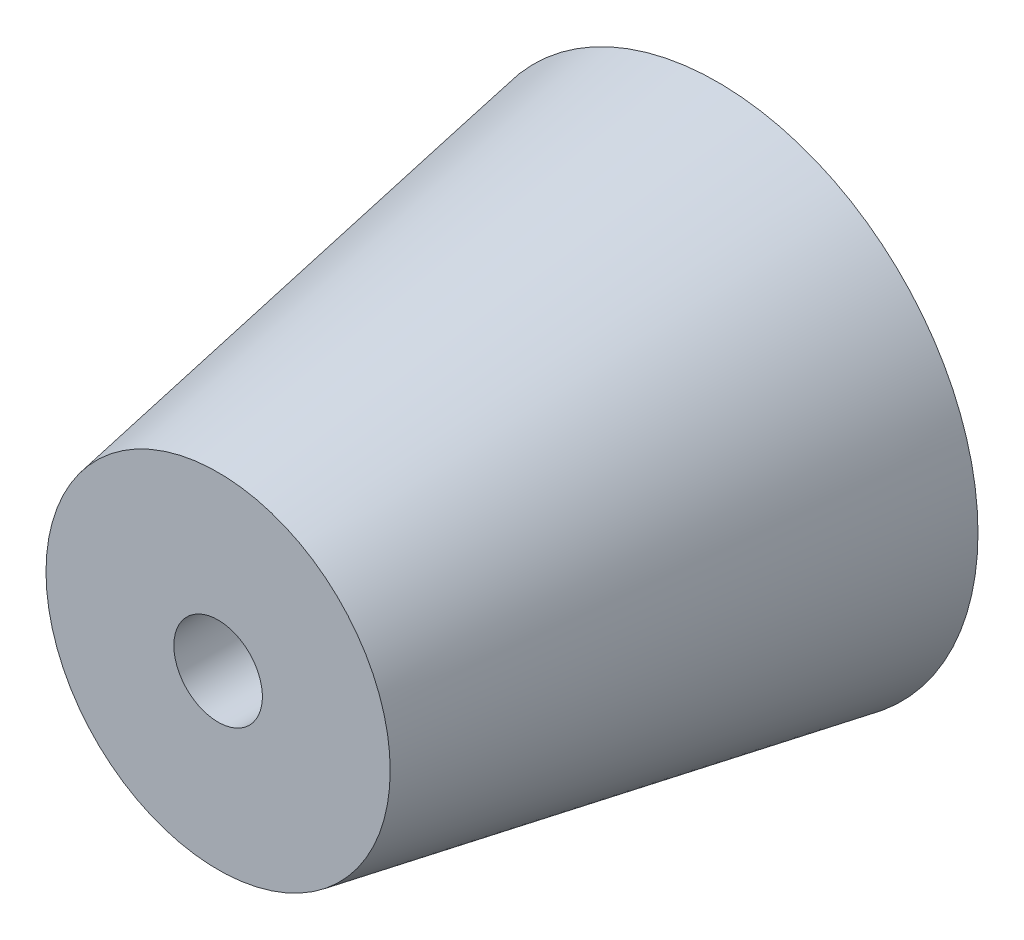
from build123d import *

# Parameters (mm, degrees)
BOSS_EXTRUDE_DEPTH      = 50.8
BOSS_EXTRUDE_DEPTH_BACK = 0.01
SKETCH1_R               = 17.5
SKETCH2_R               = 4.5
CUT_EXTRUDE1_DEPTH      = 64.101758025
SKETCH3_R               = 11.5
CUT_EXTRUDE3_DEPTH      = 8


# Read off the part's stored shape, not the designer's step: Draft3
with BuildPart() as part:
    # Sketch1 → Boss-Extrude (new, two sides: drawn at the far end of the back side and taken through both)
    with BuildSketch(Plane.XY.offset(-BOSS_EXTRUDE_DEPTH_BACK)):
        Circle(SKETCH1_R)
    extrude(amount=BOSS_EXTRUDE_DEPTH + BOSS_EXTRUDE_DEPTH_BACK)

    # Draft3 outline → Draft3 (revolve)
    with BuildSketch(Plane.XZ):
        Polygon((26.45917389, -0.01), (17.5, 50.8), (17.5, -0.01), align=None)
    revolve(axis=Axis((0, 0, 0), (0, 0, 1)))

    # Sketch2 → Cut-Extrude1 (cut, through all)
    with BuildSketch(Plane(origin=(0, 0, -0.01), x_dir=(-1, 0, 0), z_dir=(0, 0, -1))):
        Circle(SKETCH2_R)
    extrude(amount=-CUT_EXTRUDE1_DEPTH, mode=Mode.SUBTRACT)

    # Sketch3 → Cut-Extrude3 (cut)
    with BuildSketch(Plane(origin=(0, 0, -0.01), x_dir=(-1, 0, 0), z_dir=(0, 0, -1))):
        Circle(SKETCH3_R)
    extrude(amount=-CUT_EXTRUDE3_DEPTH, mode=Mode.SUBTRACT)


solid = part.part
